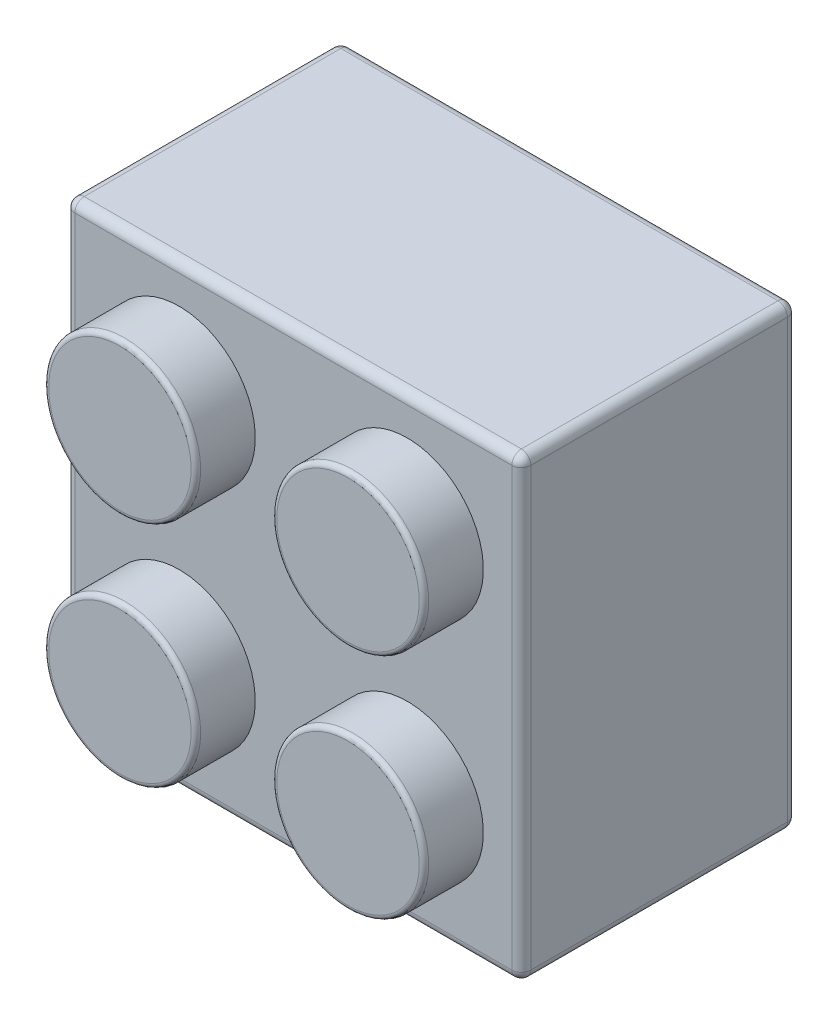
from build123d import *

# Parameters (mm, degrees)
ESQUISSE1_W        = 96
ESQUISSE1_H        = 96
ESQUISSE1_W_2      = 80
ESQUISSE1_H_2      = 80
BOSS_EXTRU_1_DEPTH = 48
ESQUISSE2_W        = 96
ESQUISSE2_H        = 96
BOSS_EXTRU_3_DEPTH = 10
ESQUISSE3_R        = 16
BOSS_EXTRU_4_DEPTH = 12.5
ESQUISSE4_R        = 18.5
ESQUISSE4_R_2      = 11.5
BOSS_EXTRU_5_DEPTH = 48
CHANFREIN1_SIZE2   = 48
CHANFREIN1_SIZE    = 4.199455849
CONG_1_R           = 2
CONG_2_R           = 2
CONG_3_R           = 2
CONG_4_R           = 2
CONG_5_R           = 1
CONG_6_R           = 1


with BuildPart() as part:
    # Esquisse1 → Boss.-Extru.1 (new body)
    with BuildSketch(Plane.XY):
        Rectangle(ESQUISSE1_W, ESQUISSE1_H)
        Rectangle(ESQUISSE1_W_2, ESQUISSE1_H_2, mode=Mode.SUBTRACT)
    extrude(amount=BOSS_EXTRU_1_DEPTH)

    # Esquisse2 → Boss.-Extru.3 (add)
    with BuildSketch(Plane.XY.offset(48)):
        Rectangle(ESQUISSE2_W, ESQUISSE2_H)
    extrude(amount=BOSS_EXTRU_3_DEPTH)

    # Esquisse3 → Boss.-Extru.4 (add)
    with BuildSketch(Plane.XY.offset(58)):
        with Locations(Location((-24, 24, 0), (0, 0, 180))):
            Circle(ESQUISSE3_R)
        with Locations(Location((24, 24, 0), (0, 0, 180))):
            Circle(ESQUISSE3_R)
        with Locations(Location((24, -24, 0), (0, 0, 180))):
            Circle(ESQUISSE3_R)
        with Locations(Location((-24, -24, 0), (0, 0, 180))):
            Circle(ESQUISSE3_R)
    extrude(amount=BOSS_EXTRU_4_DEPTH)

    # Esquisse4 → Boss.-Extru.5 (add)
    with BuildSketch(Plane(origin=(0, 0, 0), x_dir=(-1, 0, 0), z_dir=(0, 0, -1))):
        Circle(ESQUISSE4_R)
        Circle(ESQUISSE4_R_2, mode=Mode.SUBTRACT)
    extrude(amount=-BOSS_EXTRU_5_DEPTH)

    # Chanfrein1
    chanfrein1_edges = [part.edges().sort_by_distance(p)[0] for p in [
        (18.5, 0, 48),
    ]]
    chanfrein1_side = [part.faces().sort_by_distance(p)[0] for p in [
        (18.583989117, 0, 48),
    ]]
    chamfer(chanfrein1_edges, length=CHANFREIN1_SIZE - 0.0001, length2=CHANFREIN1_SIZE2 - 0.0001, reference=chanfrein1_side[0])  # a hair under: the kernel refuses the full size

    # Congé1
    cong_1_edges = [part.edges().sort_by_distance(p)[0] for p in [
        (-48, 0, 0),
    ]]
    fillet(cong_1_edges, radius=CONG_1_R)

    # Congé2
    cong_2_edges = [part.edges().sort_by_distance(p)[0] for p in [
        (1, -48, 0),
        (-47.414213562, -48, 0.585786438),
        (-48, -48, 30),
    ]]
    fillet(cong_2_edges, radius=CONG_2_R)

    # Congé3
    cong_3_edges = [part.edges().sort_by_distance(p)[0] for p in [
        (48, -48, 30),
        (48, 1, 0),
        (48, -47.414213562, 0.585786438),
    ]]
    fillet(cong_3_edges, radius=CONG_3_R)

    # Congé4
    cong_4_edges = [part.edges().sort_by_distance(p)[0] for p in [
        (-40, 0, 0),
        (0, -40, 0),
        (40, 0, 0),
        (0, 40, 0),
        (-40, 0, 48),
        (0, 48, 58),
        (48, 1, 58),
        (-47.414213562, 48, 0.585786438),
        (-48, 48, 30),
        (48, 48, 30),
        (-48, 1, 58),
        (-47.414213562, -47.414213562, 58),
        (0, -48, 58),
        (47.414213562, -47.414213562, 58),
        (0, 48, 0),
        (47.414213562, 48, 0.585786438),
    ]]
    fillet(cong_4_edges, radius=CONG_4_R)

    # Congé5
    cong_5_edges = [part.edges().sort_by_distance(p)[0] for p in [
        (-8, 24, 70.5),
        (40, 24, 70.5),
        (40, -24, 70.5),
        (-8, -24, 70.5),
    ]]
    fillet(cong_5_edges, radius=CONG_5_R)

    # Congé6
    cong_6_edges = [part.edges().sort_by_distance(p)[0] for p in [
        (11.5, 0, 0),
        (18.5, 0, 0),
    ]]
    fillet(cong_6_edges, radius=CONG_6_R)


solid = part.part
